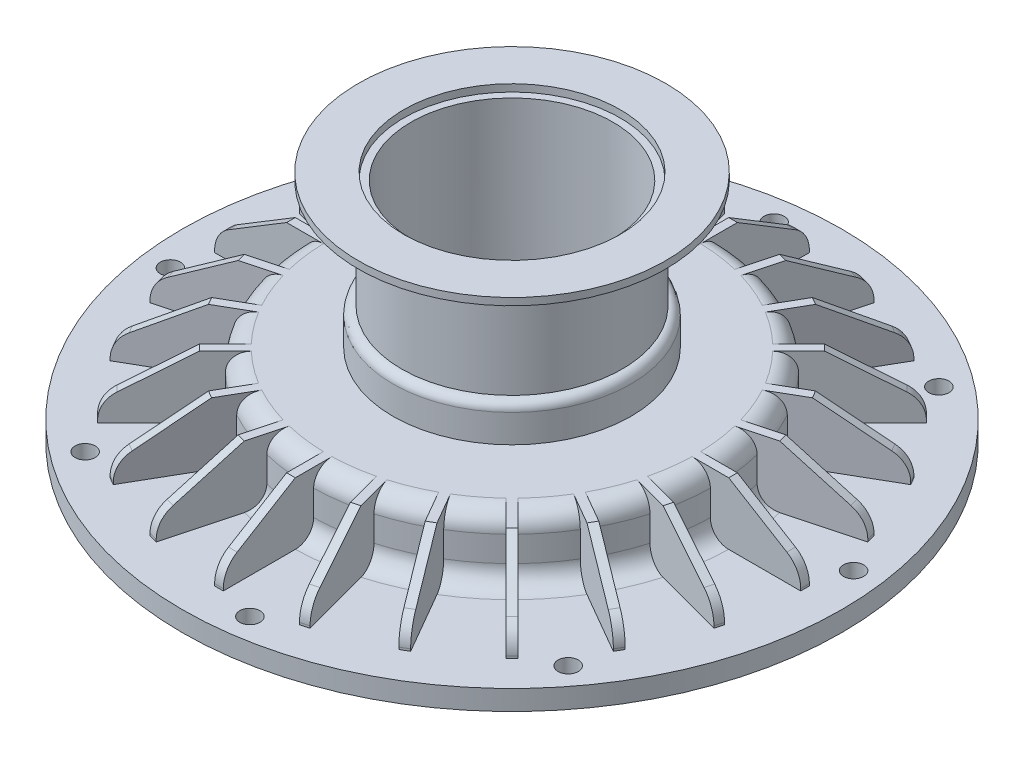
from build123d import *

# Parameters (mm, degrees)
SKETCH2_R                = 3.5
CUT_EXTRUDE1_DEPTH       = 163.998082811
CIRPATTERN1_COUNT        = 8
FILLET2_R                = 6.35
RIB1_START               = 63.88239184
RIB1_OUTLINE_W           = 21.5
RIB1_OUTLINE_H           = 3
RIB1_DEPTH               = 12.71760816
RIB1_START_2             = -1.5
RIB1_2_DEPTH             = 3
FILLET3_R                = 10
CIRPATTERN2_COUNT        = 24
FILLET3_OF_CIRPATTERN2_R = 10
SKETCH4_R                = 41.25
BOSS_EXTRUDE1_DEPTH      = 12.7
FILLET4_R                = 3
SKETCH5_R                = 35
CUT_EXTRUDE2_DEPTH       = 169.567278853
SKETCH6_R                = 62.25
CUT_EXTRUDE3_DEPTH       = 25.4
BOSS_EXTRUDE2_START      = 40
SKETCH7_R                = 38.25
SKETCH7_R_2              = 35
BOSS_EXTRUDE2_DEPTH      = 40
SKETCH9_R                = 37.5
SKETCH9_R_2              = 35
CUT_EXTRUDE4_DEPTH       = 2.5


with BuildPart() as part:
    # Sketch1 → Revolve1 (revolve)
    with BuildSketch(Plane(origin=(0, 0, 0), x_dir=(0, 0, -1), z_dir=(1, 0, 0)), mode=Mode.PRIVATE) as revolve1_sk:
        Polygon((-10, 35.35), (-70.25, 35.35), (-70.25, 13.85), (-114.25, 13.85), (-114.25, 6.925), (-101.55, 6.925), (-101.55, 0), (-20.05, 0), (-20.05, 6.35), (-16.88, 6.35), (-16.88, 25.35), (-10, 25.35), align=None)
    revolve(revolve1_sk.sketch.rotate(Axis((0, 0, 0), (0, 1, 0)), 180), axis=Axis((0, 0, 0), (0, 1, 0)))

    # Sketch2 → Cut-Extrude1 (cut, through all)
    with BuildSketch(Plane(origin=(0, 13.85, 0), x_dir=(1, 0, 0), z_dir=(0, 1, 0))):
        with Locations(Location((104.597432875, 13.770513279, 0), (0, 0, 270))):
            Circle(SKETCH2_R)
    cut_extrude1 = extrude(amount=-CUT_EXTRUDE1_DEPTH, mode=Mode.SUBTRACT)

    # CirPattern1: Cut-Extrude1 ×8 about axis
    cirpattern1_axis = Axis((0, 0, 0), (0, 1, 0))
    for i in range(1, CIRPATTERN1_COUNT):
        add(cut_extrude1.rotate(cirpattern1_axis, i * 360 / CIRPATTERN1_COUNT), mode=Mode.SUBTRACT)

    # Fillet2
    fillet2_edges = [part.edges().sort_by_distance(p)[0] for p in [
        (0, 13.85, 70.25),
        (0, 35.35, 70.25),
    ]]
    fillet(fillet2_edges, radius=FILLET2_R)

    # Rib1: read off the stored shape, not the designer's step
    # Rib1 outline → Rib1 (add)
    with BuildSketch(Plane.YZ.offset(RIB1_START)):
        with Locations((24.6, 0)):
            Rectangle(RIB1_OUTLINE_W, RIB1_OUTLINE_H)
    rib1 = extrude(amount=RIB1_DEPTH)

    # Rib1 2 outline → Rib1 2 (add)
    with BuildSketch(Plane.XY.offset(RIB1_START_2)):
        Polygon((101.55, 13.85), (101.55, 20.2), (76.6, 35.35), (76.6, 13.85), align=None)
    rib1_2 = extrude(amount=RIB1_2_DEPTH)

    # Fillet3
    fillet3_edges = [part.edges().sort_by_distance(p)[0] for p in [
        (101.55, 20.2, 0),
    ]]
    fillet(fillet3_edges, radius=FILLET3_R)

    # CirPattern2: Rib1, Rib1 2 ×24 about axis
    cirpattern2_axis = Axis((0, 0, 0), (0, 1, 0))
    add([rib1.rotate(cirpattern2_axis, i * 360 / CIRPATTERN2_COUNT) for i in range(1, CIRPATTERN2_COUNT)])
    add([rib1_2.rotate(cirpattern2_axis, i * 360 / CIRPATTERN2_COUNT) for i in range(1, CIRPATTERN2_COUNT)])

    # Fillet3 of CirPattern2
    fillet3_of_cirpattern2_edges = [part.edges().sort_by_distance(p)[0] for p in [
        (98.08976766, 20.2, -26.28307403),
        (87.944879754, 20.2, -50.775),
        (71.806693629, 20.2, -71.806693629),
        (50.775, 20.2, -87.944879754),
        (26.28307403, 20.2, -98.08976766),
        (0, 20.2, -101.55),
        (-26.28307403, 20.2, -98.08976766),
        (-50.775, 20.2, -87.944879754),
        (-71.806693629, 20.2, -71.806693629),
        (-87.944879754, 20.2, -50.775),
        (-98.08976766, 20.2, -26.28307403),
        (-101.55, 20.2, 0),
        (-98.08976766, 20.2, 26.28307403),
        (-87.944879754, 20.2, 50.775),
        (-71.806693629, 20.2, 71.806693629),
        (-50.775, 20.2, 87.944879754),
        (-26.28307403, 20.2, 98.08976766),
        (0, 20.2, 101.55),
        (26.28307403, 20.2, 98.08976766),
        (50.775, 20.2, 87.944879754),
        (71.806693629, 20.2, 71.806693629),
        (87.944879754, 20.2, 50.775),
        (98.08976766, 20.2, 26.28307403),
    ]]
    fillet(fillet3_of_cirpattern2_edges, radius=FILLET3_OF_CIRPATTERN2_R)

    # Sketch4 → Boss-Extrude1 (add)
    with BuildSketch(Plane(origin=(0, 35.35, 0), x_dir=(1, 0, 0), z_dir=(0, 1, 0))):
        with Locations(Location((0, 0, 0), (0, 0, 90))):
            Circle(SKETCH4_R)
    extrude(amount=BOSS_EXTRUDE1_DEPTH)

    # Fillet4
    fillet4_edges = [part.edges().sort_by_distance(p)[0] for p in [
        (0, 48.05, 41.25),
    ]]
    fillet(fillet4_edges, radius=FILLET4_R)

    # Sketch5 → Cut-Extrude2 (cut, through all)
    with BuildSketch(Plane(origin=(0, 48.05, 0), x_dir=(1, 0, 0), z_dir=(0, 1, 0))):
        with Locations(Location((0, 0, 0), (0, 0, 270))):
            Circle(SKETCH5_R)
    extrude(amount=-CUT_EXTRUDE2_DEPTH, mode=Mode.SUBTRACT)

    # Sketch6 → Cut-Extrude3 (cut)
    with BuildSketch(Plane.XZ):
        with Locations(Location((0, 0, 0), (0, 0, 270))):
            Circle(SKETCH6_R)
    extrude(amount=-CUT_EXTRUDE3_DEPTH, mode=Mode.SUBTRACT)

    # Sketch7 → Boss-Extrude2 (add)
    with BuildSketch(Plane(origin=(0, 48.05, 0), x_dir=(1, 0, 0), z_dir=(0, 1, 0)).offset(BOSS_EXTRUDE2_START)):
        with Locations(Location((0, 0, 0), (0, 0, 270))):
            Circle(SKETCH7_R)
        with Locations(Location((0, 0, 0), (0, 0, 270))):
            Circle(SKETCH7_R_2, mode=Mode.SUBTRACT)
    extrude(amount=-BOSS_EXTRUDE2_DEPTH)

    # Sketch8 → Revolve3 (revolve)
    with BuildSketch(Plane(origin=(0, 0, 0), x_dir=(0, 0, -1), z_dir=(1, 0, 0))):
        Polygon((38.25, 88.05), (38.25, 78.05), (40.187822174, 78.05), (40.187822174, 82.05), (53.25, 85.55), (53.25, 88.05), align=None)
    revolve(axis=Axis((0, 0, 0), (0, 1, 0)))

    # Sketch9 → Cut-Extrude4 (cut)
    with BuildSketch(Plane(origin=(0, 88.05, 0), x_dir=(1, 0, 0), z_dir=(0, 1, 0))):
        with Locations(Location((0, 0, 0), (0, 0, 270))):
            Circle(SKETCH9_R)
        with Locations(Location((0, 0, 0), (0, 0, 270))):
            Circle(SKETCH9_R_2, mode=Mode.SUBTRACT)
    extrude(amount=-CUT_EXTRUDE4_DEPTH, mode=Mode.SUBTRACT)


solid = part.part
